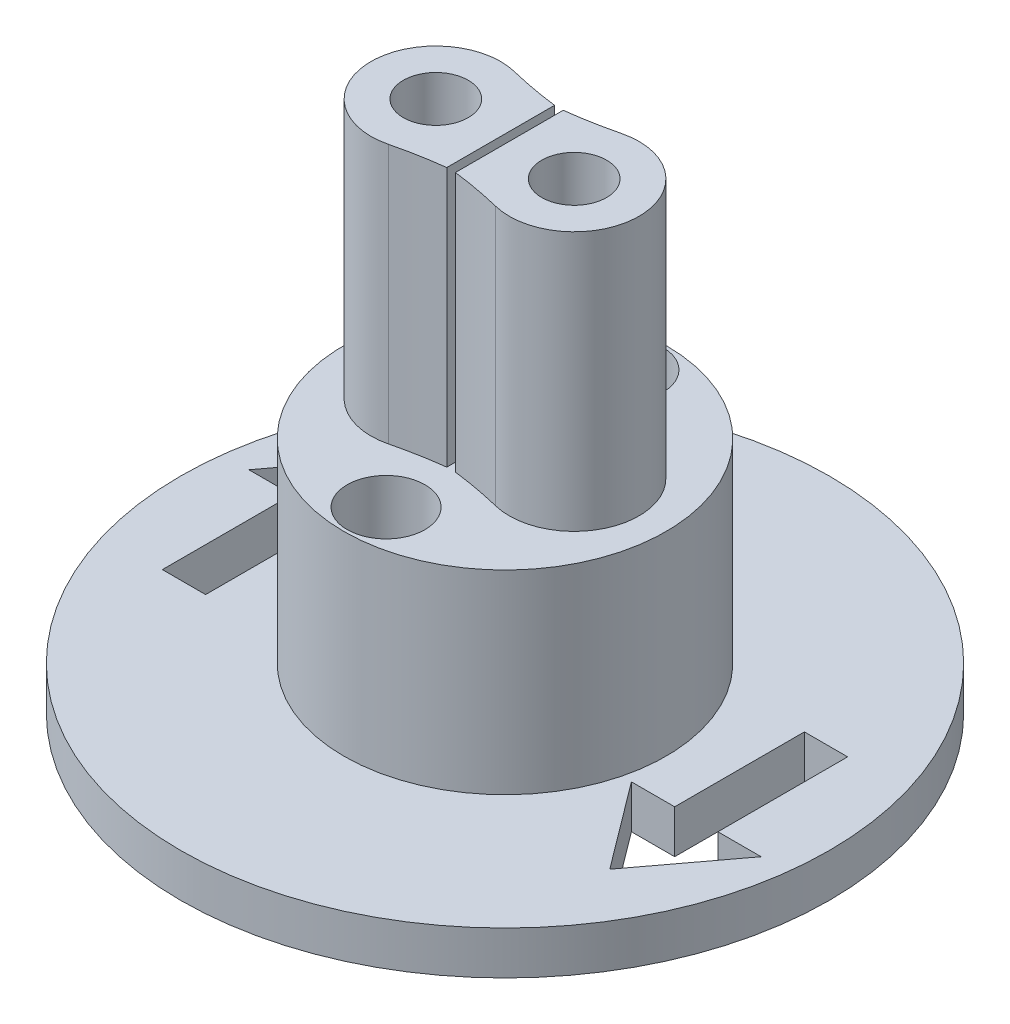
from build123d import *

# Parameters (mm, degrees)
SKETCH1_R           = 9.4615
BOSS_EXTRUDE1_DEPTH = 13.97
SKETCH2_R           = 1.905
CUT_EXTRUDE1_DEPTH  = 20.344272137
BOSS_EXTRUDE2_START = 15.24
SKETCH4_R           = 1.905
BOSS_EXTRUDE2_DEPTH = 15.24
FILLET1_R           = 25.4
SKETCH5_R           = 2.286
CUT_EXTRUDE2_DEPTH  = 33.12886653
SKETCH6_R           = 19.05
SKETCH6_R_2         = 9.4615
BOSS_EXTRUDE3_DEPTH = 2.54
SKETCH7_W           = 2.54
SKETCH7_H           = 7.62
CUT_EXTRUDE3_DEPTH  = 40.736999132
CIRPATTERN1_COUNT   = 2


with BuildPart() as part:
    # Sketch1 → Boss-Extrude1 (new body)
    with BuildSketch(Plane(origin=(0, 0, 0), x_dir=(1, 0, 0), z_dir=(0, 1, 0))):
        with Locations(Location((0, 0, 0), (0, 0, 270))):
            Circle(SKETCH1_R)
    extrude(amount=BOSS_EXTRUDE1_DEPTH)

    # Sketch2 → Cut-Extrude1 (cut, through all)
    with BuildSketch(Plane(origin=(0, 13.97, 0), x_dir=(1, 0, 0), z_dir=(0, 1, 0))):
        with Locations(Location((-4.064, 0, 0), (0, 0, 270))):
            Circle(SKETCH2_R)
        with Locations(Location((4.064, 0, 0), (0, 0, 270))):
            Circle(SKETCH2_R)
    extrude(amount=-CUT_EXTRUDE1_DEPTH, mode=Mode.SUBTRACT)

    # Sketch4 → Boss-Extrude2 (add)
    # profile 1 of 2: a face of its own
    with BuildSketch(Plane(origin=(0, 13.97, 0), x_dir=(1, 0, 0), z_dir=(0, 1, 0)).offset(BOSS_EXTRUDE2_START)):
        with BuildLine():
            Line((-0.254, -3.164823692), (-0.254, 3.164823692))
            ThreePointArc((-0.254, 3.164823692), (-0.888489589, 3.048148824), (-1.486296875, 2.805627666))
            ThreePointArc((-1.486296875, 2.805627666), (-7.874, 0), (-1.486296875, -2.805627666))
            ThreePointArc((-1.486296875, -2.805627666), (-0.888489589, -3.048148824), (-0.254, -3.164823692))
        make_face()
        with Locations(Location((-4.064, 0, 0), (0, 0, 270))):
            Circle(SKETCH4_R, mode=Mode.SUBTRACT)
    # profile 2 of 2: a face of its own
    with BuildSketch(Plane(origin=(0, 13.97, 0), x_dir=(1, 0, 0), z_dir=(0, 1, 0)).offset(BOSS_EXTRUDE2_START)):
        with BuildLine():
            ThreePointArc((1.486296875, 2.805627666), (0.888489589, 3.048148824), (0.254, 3.164823692))
            Line((0.254, 3.164823692), (0.254, -3.164823692))
            ThreePointArc((0.254, -3.164823692), (0.888489589, -3.048148824), (1.486296875, -2.805627666))
            ThreePointArc((1.486296875, -2.805627666), (7.874, 0), (1.486296875, 2.805627666))
        make_face()
        with Locations(Location((4.064, 0, 0), (0, 0, 270))):
            Circle(SKETCH4_R, mode=Mode.SUBTRACT)
    extrude(amount=-BOSS_EXTRUDE2_DEPTH)

    # Fillet1
    # the kernel refuses this fillet: 25.4 mm, written as the material it adds along each edge
    with BuildSketch(Plane(origin=(1.486296875, 29.21, -2.805627666), x_dir=(-0.9600468735563171, 0, -0.27983924059134535), z_dir=(0, -1, 0)), Plane(origin=(-1.486296875, 29.21, 2.805627666), x_dir=(0.960046873556317, 0, 0.27983924059134513), z_dir=(0, -1, 0))) as fillet1_piece_1:
        with BuildLine():
            CenterArc((11.360363176, 23.315626496), FILLET1_R, 239.965558217, 6.660918352)
            Line((-1.352857448, 1.32621947), (-1.60712186, 0.886431329))
            ThreePointArc((-1.60712186, 0.886431329), (-0.948303715, 0.385773959), (-0.434645406, -0.262958878))
            Line((-0.434645406, -0.262958878), (0.102686392, -0.497513321))
            ThreePointArc((0.102686392, -0.497513321), (0.641789953, -0.442458258), (1.08204424, -0.46631253))
            Line((1.08204424, -0.46631253), (1.283579905, 0))
        make_face()
    extrude(amount=19.97621774)
    with BuildSketch(Plane(origin=(-1.486296875, 29.21, -2.805627666), x_dir=(-0.881470671461199, 0, -0.4722387694310403), z_dir=(0, -1, 0)), Plane(origin=(1.486296875, 29.21, 2.805627666), x_dir=(0.8814706714611991, 0, 0.47223876943104), z_dir=(0, -1, 0))) as fillet1_piece_2:
        with BuildLine():
            CenterArc((8.209444083, 24.602465695), FILLET1_R, 248.943194802, 6.660918352)
            Line((-0.916607265, 0.898559122), (-1.099128292, 0.424480991))
            ThreePointArc((-1.099128292, 0.424480991), (-0.768042747, 0.133319135), (-0.421608522, -0.283390639))
            Line((-0.421608522, -0.283390639), (0.12629914, -0.492049314))
            ThreePointArc((0.12629914, -0.492049314), (0.947243548, -0.388369854), (1.768187956, -0.492049314))
            Line((1.768187956, -0.492049314), (1.894487096, 0))
        make_face()
    extrude(amount=19.97621774)

    # Sketch5 → Cut-Extrude2 (cut, through all)
    with BuildSketch(Plane.XZ):
        with Locations(Location((0, 6.985, 0), (0, 0, 270))):
            Circle(SKETCH5_R)
        with Locations(Location((0, -6.985, 0), (0, 0, 90))):
            Circle(SKETCH5_R)
    extrude(amount=-CUT_EXTRUDE2_DEPTH, mode=Mode.SUBTRACT)

    # Sketch6 → Boss-Extrude3 (add)
    with BuildSketch(Plane.XZ):
        with Locations(Location((0, 0, 0), (0, 0, 270))):
            Circle(SKETCH6_R)
        with Locations(Location((0, 0, 0), (0, 0, 90))):
            Circle(SKETCH6_R_2, mode=Mode.SUBTRACT)
    extrude(amount=-BOSS_EXTRUDE3_DEPTH)

    # Sketch7 → Cut-Extrude3 (cut, through all)
    with BuildSketch(Plane.XZ):
        with Locations((13.554224028, -1.490382181)):
            Rectangle(SKETCH7_W, SKETCH7_H)
        Polygon((17.364224028, 2.319617819), (14.824224028, 2.319617819), (12.284224028, 2.319617819), (9.744224028, 2.319617819), (13.554224028, 7.399617819), align=None)
    cut_extrude3 = extrude(amount=-CUT_EXTRUDE3_DEPTH, mode=Mode.SUBTRACT)

    # CirPattern1: Cut-Extrude3 ×2 about axis
    cirpattern1_axis = Axis((0, 0, 0), (0, 1, 0))
    for i in range(1, CIRPATTERN1_COUNT):
        add(cut_extrude3.rotate(cirpattern1_axis, i * 360 / CIRPATTERN1_COUNT), mode=Mode.SUBTRACT)


solid = part.part
